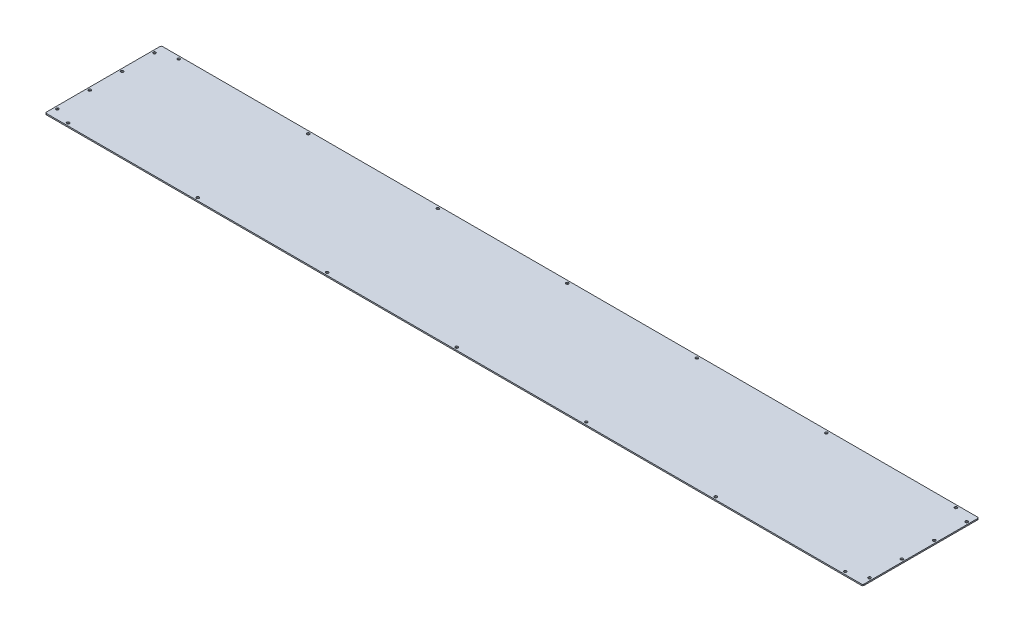
from build123d import *

# Parameters (mm, degrees)
SKETCH1_W                   = 1924.05
SKETCH1_H                   = 273.05
BOSS_EXTRUDE1_DEPTH         = 2.9972
FILLET1_R                   = 3.175
F_1_4_0_25_DIAMETER_HOLE1_D = 6.35


with BuildPart() as part:
    # Sketch1 → Boss-Extrude1 (new body)
    with BuildSketch(Plane(origin=(0, 0, 0), x_dir=(1, 0, 0), z_dir=(0, 1, 0))):
        Rectangle(SKETCH1_W, SKETCH1_H)
    extrude(amount=BOSS_EXTRUDE1_DEPTH)

    # Fillet1
    fillet1_edges = [part.edges().sort_by_distance(p)[0] for p in [
        (962.025, 1.4986, 136.525),
        (962.025, 1.4986, -136.525),
        (-962.025, 1.4986, 136.525),
        (-962.025, 1.4986, -136.525),
    ]]
    fillet(fillet1_edges, radius=FILLET1_R)

    # 1/4 (0.25) Diameter Hole1 (through all)
    with Locations(Plane(origin=(0, 2.9972, 0), x_dir=(1, 0, 0), z_dir=(0, 1, 0))):
        with Locations((0, -130.175), (-955.675, 38.1), (-955.675, -38.1), (-914.4, -130.175), (-609.6, -130.175), (-304.8, -130.175), (304.8, -130.175), (609.6, -130.175), (914.4, -130.175), (-955.675, -114.3), (914.4, 130.175), (609.6, 130.175), (304.8, 130.175), (-304.8, 130.175), (-609.6, 130.175), (-914.4, 130.175), (0, 130.175), (955.675, -114.3), (955.675, -38.1), (955.675, 38.1), (-955.675, 114.3), (955.675, 114.3)):
            Hole(F_1_4_0_25_DIAMETER_HOLE1_D / 2)


solid = part.part
